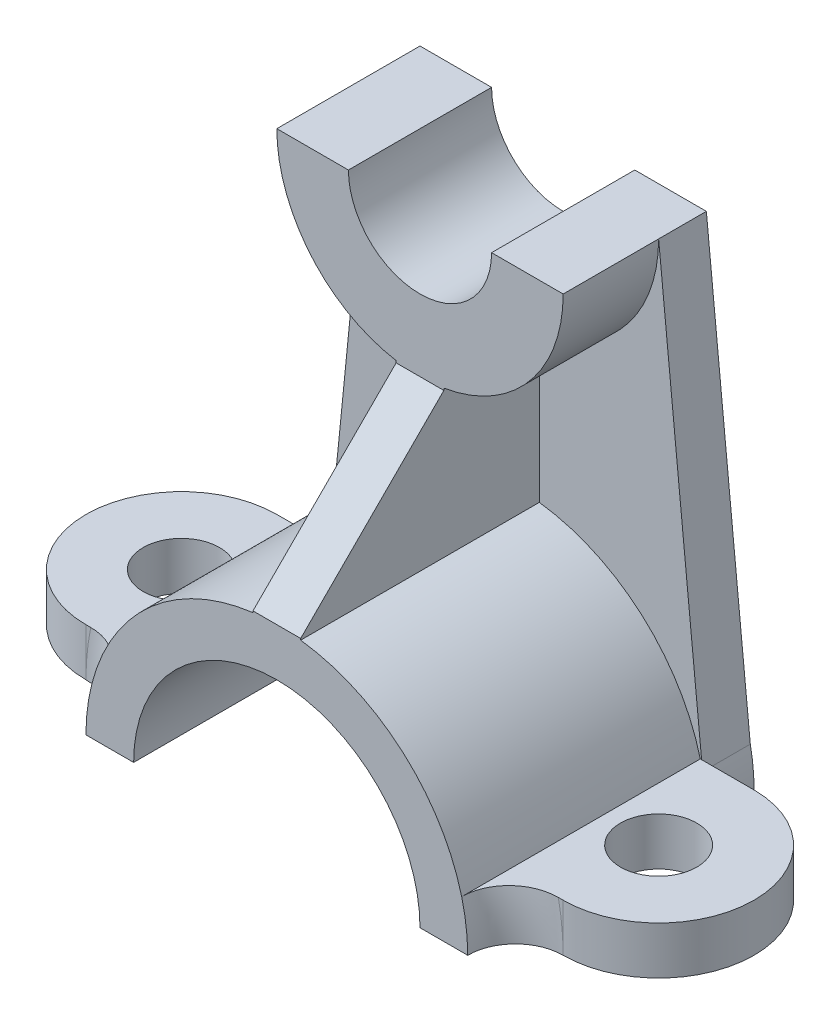
from build123d import *
from build123d.topology import SkipClean

# Parameters (mm, degrees)
BOSS_EXTRUDE2_DEPTH  = 60
BOSS_EXTRUDE3_START  = 30
SKETCH4_W            = 40
SKETCH4_H            = 10
BOSS_EXTRUDE3_DEPTH  = 20
FILLET1_R            = 10
FILLET2_R            = 10
BOSS_EXTRUDE7_DEPTH  = 10
CUT_EXTRUDE2_DEPTH   = 10
BOSS_EXTRUDE8_START  = -10
BOSS_EXTRUDE8_DEPTH  = 10
BOSS_EXTRUDE18_START = -30
BOSS_EXTRUDE18_DEPTH = 20
MIRROR9_START        = -60
MIRROR9_DEPTH        = 30
BOSS_EXTRUDE20_DEPTH = 5


# Read off the part's stored shape, not the designer's step: Boss-Extrude8, Boss-Extrude18, Mirror9
with BuildPart() as part:
    # Sketch1 → Boss-Extrude2 (new body)
    with BuildSketch(Plane.XY):
        with BuildLine():
            ThreePointArc((40, 0), (0, 40), (-40, 0))
            Line((-40, 0), (-30, 0))
            ThreePointArc((-30, 0), (0, 30), (30, 0))
            Line((30, 0), (40, 0))
        make_face()
    extrude(amount=-BOSS_EXTRUDE2_DEPTH)

    # Sketch4 → Boss-Extrude3 (add)
    with BuildSketch(Plane(origin=(0, 0, 0), x_dir=(0, 0, -1), z_dir=(1, 0, 0)).offset(BOSS_EXTRUDE3_START)):
        with Locations((30, 5)):
            Rectangle(SKETCH4_W, SKETCH4_H)
    boss_extrude3 = extrude(amount=BOSS_EXTRUDE3_DEPTH)

    # Mirror1: Boss-Extrude3 across plane
    add(boss_extrude3.mirror(Plane(origin=(0, 0, 0), x_dir=(0, 0, 1), z_dir=(1, 0, 0))))

    # Fillet1
    fillet1_edges = [part.edges().sort_by_distance(p)[0] for p in [
        (-39.681187851, 5.040171699, -10),
    ]]
    fillet(fillet1_edges, radius=FILLET1_R - 0.0001)  # a hair under: the kernel refuses the full size

    # Fillet2
    fillet2_edges = [part.edges().sort_by_distance(p)[0] for p in [
        (39.681187851, 5.040171699, -10),
    ]]
    fillet(fillet2_edges, radius=FILLET2_R - 0.0001)  # a hair under: the kernel refuses the full size

    # Sketch5 → Boss-Extrude7 (add)
    with BuildSketch(Plane(origin=(0, 10, 0), x_dir=(1, 0, 0), z_dir=(0, 1, 0))):
        with BuildLine():
            ThreePointArc((50, 10), (70, 30), (50, 50))
            Line((50, 50), (50, 38))
            ThreePointArc((50, 38), (55.656854249, 35.656854249), (58, 30))
            ThreePointArc((58, 30), (55.656854249, 24.343145751), (50, 22))
            Line((50, 22), (50, 10))
        make_face()
    boss_extrude7 = extrude(amount=-BOSS_EXTRUDE7_DEPTH)

    # Sketch5<5> → Cut-Extrude2 (cut)
    with SkipClean():  # the faces are left unmerged after this step: merging them gives an invalid solid
        with BuildSketch(Plane(origin=(0, 10, 0), x_dir=(1, 0, 0), z_dir=(0, 1, 0))):
            with BuildLine():
                Line((50, 22), (50, 38))
                ThreePointArc((50, 38), (42, 30), (50, 22))
            make_face()
            with BuildLine():
                ThreePointArc((58, 30), (55.656854249, 35.656854249), (50, 38))
                Line((50, 38), (50, 22))
                ThreePointArc((50, 22), (55.656854249, 24.343145751), (58, 30))
            make_face()
        cut_extrude2 = extrude(amount=-CUT_EXTRUDE2_DEPTH, mode=Mode.SUBTRACT)

    # Mirror3: Boss-Extrude7, Cut-Extrude2 across plane
    with SkipClean():  # the faces are left unmerged after this step: merging them gives an invalid solid
        add(boss_extrude7.mirror(Plane(origin=(0, 0, 0), x_dir=(0, 0, 1), z_dir=(1, 0, 0))))
        add(cut_extrude2.mirror(Plane(origin=(0, 0, 0), x_dir=(0, 0, 1), z_dir=(1, 0, 0))), mode=Mode.SUBTRACT)

    # Boss-Extrude8 outline → Boss-Extrude8 (add)
    with SkipClean():  # the faces are left unmerged after this step: merging them gives an invalid solid
        with BuildSketch(Plane(origin=(0, 0, -60), x_dir=(-1, 0, 0), z_dir=(0, 0, -1)).offset(BOSS_EXTRUDE8_START)):
            with BuildLine():
                ThreePointArc((30.000032068, 99.999679323), (21.213112735, 78.786660512), (0, 69.999967931))
                Line((0, 69.999967931), (0, 85))
                ThreePointArc((0, 85), (-10.606601718, 89.393398282), (-15, 100))
                Line((-15, 100), (-30, 100))
                Line((-30, 100), (-39.207920792, 7.920792079))
                ThreePointArc((-39.207920792, 7.920792079), (0, 40), (39.207920792, 7.920792079))
                Line((39.207920792, 7.920792079), (30.000032068, 99.999679323))
            make_face()
        extrude(amount=BOSS_EXTRUDE8_DEPTH)

    # Boss-Extrude18 outline → Boss-Extrude18 (add)
    with SkipClean():  # the faces are left unmerged after this step: merging them gives an invalid solid
        with BuildSketch(Plane(origin=(0, 0, -60), x_dir=(-1, 0, 0), z_dir=(0, 0, -1)).offset(BOSS_EXTRUDE18_START)):
            with BuildLine():
                ThreePointArc((0, 85), (-10.606601718, 89.393398282), (-15, 100))
                Line((-15, 100), (-30, 100))
                Line((-30, 100), (-30.000032068, 99.999679323))
                ThreePointArc((-30.000032068, 99.999679323), (-21.213112735, 78.786660512), (0, 69.999967931))
                Line((0, 69.999967931), (0, 85))
            make_face()
        extrude(amount=BOSS_EXTRUDE18_DEPTH)

    # Mirror9 outline → Mirror9 (add)
    with SkipClean():  # the faces are left unmerged after this step: merging them gives an invalid solid
        with BuildSketch(Plane.XY.offset(MIRROR9_START)):
            with BuildLine():
                Line((-15, 100), (-30, 100))
                Line((-30, 100), (-30.000032068, 99.999679323))
                ThreePointArc((-30.000032068, 99.999679323), (-21.213112735, 78.786660512), (0, 69.999967931))
                Line((0, 69.999967931), (0, 85))
                ThreePointArc((0, 85), (-10.606601718, 89.393398282), (-15, 100))
            make_face()
        extrude(amount=MIRROR9_DEPTH)

    # Sketch7 → Boss-Extrude20 (add, symmetric)
    with SkipClean():  # the faces are left unmerged after this step: merging them gives an invalid solid
        with BuildSketch(Plane(origin=(0, 0, 0), x_dir=(0, 0, -1), z_dir=(1, 0, 0))):
            Polygon((0, 40), (30, 69.999967931), (30, 70.999967931), (50, 70.999967931), (50, 69.999967931), (50, 40), (50, 39), (0, 39), align=None)
        extrude(amount=BOSS_EXTRUDE20_DEPTH, both=True)


solid = part.part
